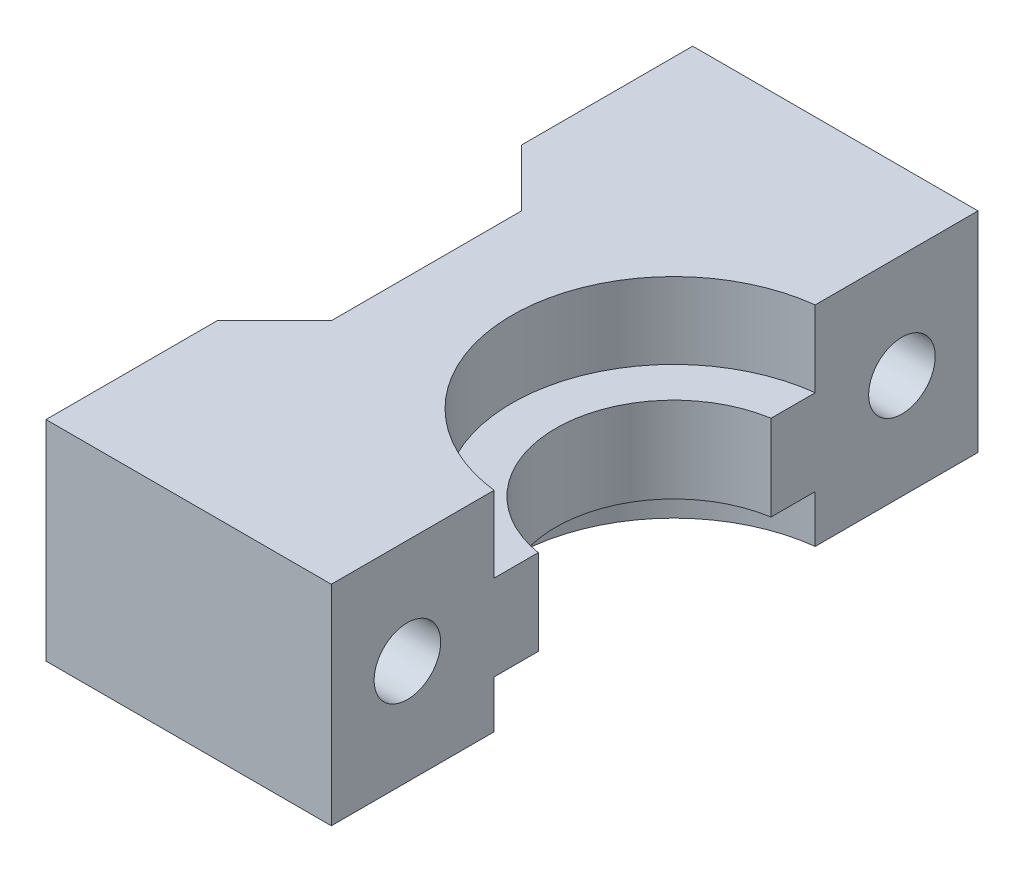
from build123d import *

# Parameters (mm, degrees)
SKETCH2_W           = 34
SKETCH2_H           = 11
SKETCH2_R           = 1.75
BOSS_EXTRUDE1_DEPTH = 16
SKETCH5_W           = 1
SKETCH5_H           = 34
SKETCH5_W_2         = 3
SKETCH5_H_2         = 10
CUT_EXTRUDE1_DEPTH  = 40.153543901
CHAMFER1_SIZE       = 3


with BuildPart() as part:
    # Sketch2 → Boss-Extrude1 (new body)
    with BuildSketch(Plane(origin=(0, 0, 0), x_dir=(0, 0, -1), z_dir=(1, 0, 0))):
        with Locations((-17, 5.5)):
            Rectangle(SKETCH2_W, SKETCH2_H)
        with Locations((-30, 5.5)):
            Circle(SKETCH2_R, mode=Mode.SUBTRACT)
        with Locations((-4, 5.5)):
            Circle(SKETCH2_R, mode=Mode.SUBTRACT)
    extrude(amount=-BOSS_EXTRUDE1_DEPTH)

    # Sketch4 → Cut-Revolve1 (revolve, cut)
    with BuildSketch(Plane(origin=(0, 0, 0), x_dir=(0, 0, -1), z_dir=(1, 0, 0))):
        Polygon((-17, 0), (-25.5, 0), (-25.5, 2.5), (-23.2, 2.5), (-23.2, 7), (-25.5, 7), (-25.5, 11), (-17, 11), align=None)
    revolve(axis=Axis((0, 0, 17), (0, 1, 0)), mode=Mode.SUBTRACT)

    # Sketch5 → Cut-Extrude1 (cut, through all)
    with BuildSketch(Plane(origin=(0, 11, 0), x_dir=(1, 0, 0), z_dir=(0, 1, 0))):
        with Locations((-0.5, -17)):
            Rectangle(SKETCH5_W, SKETCH5_H)
        with Locations((-14.5, -17)):
            Rectangle(SKETCH5_W_2, SKETCH5_H_2)
    extrude(amount=-CUT_EXTRUDE1_DEPTH, mode=Mode.SUBTRACT)

    # Chamfer1
    chamfer1_edges = [part.edges().sort_by_distance(p)[0] for p in [
        (-16, 5.5, 22),
        (-16, 5.5, 12),
    ]]
    chamfer(chamfer1_edges, length=CHAMFER1_SIZE - 0.0001)  # a hair under: the kernel refuses the full size


solid = part.part
